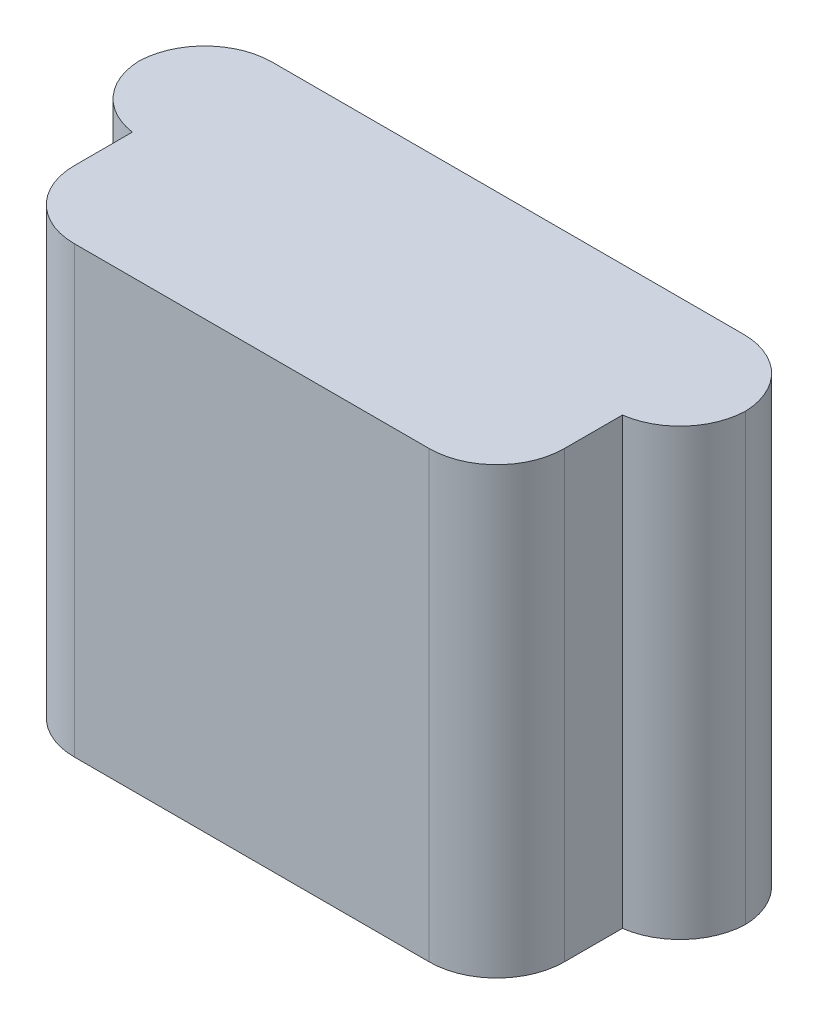
from build123d import *

# Parameters (mm, degrees)
SKETCH1_W           = 91.2368
SKETCH1_H           = 66.8782
BASE_FLANGE1_DEPTH  = 0.7366
SKETCH6_W           = 91.2368
SKETCH6_H           = 66.8782
BOSS_EXTRUDE1_DEPTH = 37.7952
SKETCH8_W           = 8.763
SKETCH8_H           = 66.8782
CUT_EXTRUDE2_DEPTH  = 18.8976
FILLET1_R           = 10.16


# Sheet-metal steps are written as plain solids
with BuildPart() as part:
    # Sketch1 → Base-Flange1 (new body)
    with BuildSketch(Plane.XY):
        with Locations((0, 33.4391)):
            Rectangle(SKETCH1_W, SKETCH1_H)
    extrude(amount=-BASE_FLANGE1_DEPTH)

    # Sketch6 → Boss-Extrude1 (add)
    with BuildSketch(Plane.XY):
        with Locations((0, 33.4391)):
            Rectangle(SKETCH6_W, SKETCH6_H)
    extrude(amount=BOSS_EXTRUDE1_DEPTH)

    # Sketch8 → Cut-Extrude2 (cut)
    with BuildSketch(Plane.XY.offset(37.7952)):
        with Locations((-41.2369, 33.4391)):
            Rectangle(SKETCH8_W, SKETCH8_H)
    cut_extrude2 = extrude(amount=-CUT_EXTRUDE2_DEPTH, mode=Mode.SUBTRACT)

    # Mirror1: Cut-Extrude2 across plane
    add(cut_extrude2.mirror(Plane(origin=(0, 0, 0), x_dir=(0, 0, 1), z_dir=(1, 0, 0))), mode=Mode.SUBTRACT)

    # Fillet1
    # the kernel refuses this fillet: 10.16 mm, written as the material it takes off along each edge
    with BuildSketch(Plane(origin=(-45.6184, -25.158744876, 18.8976), x_dir=(1, 0, 0), z_dir=(0, 1, 0))) as fillet1_piece_1:
        with BuildLine():
            CenterArc((10.16, 10.063497951), FILLET1_R, 180, 82.096792267)
            Line((0, 10.063497951), (-0.2032, 10.063497951))
            Line((-0.2032, 10.063497951), (-0.2032, 0))
            Line((-0.2032, 0), (0, -0.2032))
            ThreePointArc((0, -0.2032), (4.3815, -0.2032), (8.73506, -0.201269959))
            Line((8.73506, -0.201269959), (8.763, 0))
        make_face()
    extrude(amount=117.195689753, mode=Mode.SUBTRACT)
    with BuildSketch(Plane(origin=(45.6184, -25.158744876, 18.8976), x_dir=(-1, 0, 0), z_dir=(0, 1, 0))) as fillet1_piece_2:
        with BuildLine():
            CenterArc((10.16, -10.063497951), FILLET1_R, 97.903207733, 82.096792267)
            Line((0, -10.063497951), (-0.2032, -10.063497951))
            Line((-0.2032, -10.063497951), (-0.2032, 0))
            Line((-0.2032, 0), (0, 0.2032))
            ThreePointArc((0, 0.2032), (4.3815, 0.2032), (8.73506, 0.201269959))
            Line((8.73506, 0.201269959), (8.763, 0))
        make_face()
    extrude(amount=117.195689753, mode=Mode.SUBTRACT)
    with BuildSketch(Plane(origin=(36.8554, 92.2782, 37.7952), x_dir=(-1, 0, 0), z_dir=(0, -1, 0)), Plane(origin=(-36.8554, 92.2782, 37.7952), x_dir=(0, 0, -1), z_dir=(0, -1, 0)), Plane(origin=(-45.6184, 92.2782, -0.7366), x_dir=(1, 0, 0), z_dir=(0, -1, 0))) as fillet1_piece_3:
        with BuildLine():
            CenterArc((FILLET1_R, FILLET1_R), FILLET1_R, 180, 90)
            Line((0, FILLET1_R), (-FILLET1_R * 0.02, FILLET1_R))
            Line((-FILLET1_R * 0.02, FILLET1_R), (-FILLET1_R * 0.02, -FILLET1_R * 0.02))
            Line((-FILLET1_R * 0.02, -FILLET1_R * 0.02), (FILLET1_R, -FILLET1_R * 0.02))
            Line((FILLET1_R, -FILLET1_R * 0.02), (FILLET1_R, 0))
        make_face()
    extrude(amount=117.6782, mode=Mode.SUBTRACT)
    with BuildSketch(Plane(origin=(45.6184, -25.4, -0.7366), x_dir=(0, 0, 1), z_dir=(0, 1, 0))) as fillet1_piece_4:
        with BuildLine():
            CenterArc((FILLET1_R, -FILLET1_R), FILLET1_R, 90, 90)
            Line((0, -FILLET1_R), (-FILLET1_R * 0.02, -FILLET1_R))
            Line((-FILLET1_R * 0.02, -FILLET1_R), (-FILLET1_R * 0.02, FILLET1_R * 0.02))
            Line((-FILLET1_R * 0.02, FILLET1_R * 0.02), (FILLET1_R, FILLET1_R * 0.02))
            Line((FILLET1_R, FILLET1_R * 0.02), (FILLET1_R, 0))
        make_face()
    extrude(amount=117.6782, mode=Mode.SUBTRACT)


solid = part.part
